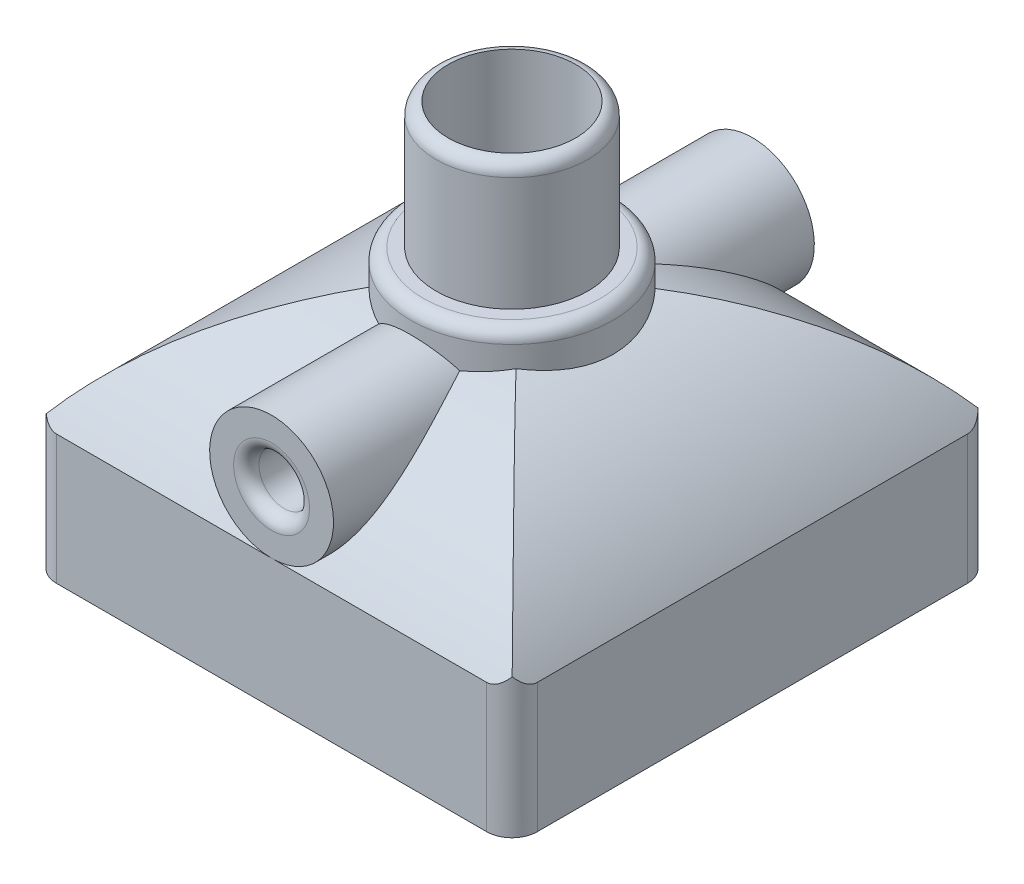
from build123d import *

# Parameters (mm, degrees)
SKETCH1_W            = 19
SKETCH1_H            = 19
BOSS_EXTRUDE1_DEPTH  = 10
CUT_EXTRUDE2_DEPTH   = 24.478713764
CUT_EXTRUDE5_START   = -18.816551442
CUT_EXTRUDE5_DEPTH   = 18.816551442
FILLET5_R            = 1
FILLET6_R            = 1
FILLET7_R            = 1
SKETCH8_R            = 2.447279851
SKETCH8_R_2          = 1
BOSS_EXTRUDE2_DEPTH  = 19
SKETCH10_R           = 4
BOSS_EXTRUDE4_DEPTH  = 4
BOSS_EXTRUDE5_START  = 6
SKETCH11_R           = 4
BOSS_EXTRUDE5_DEPTH  = 6
SKETCH12_R           = 4
SKETCH12_R_2         = 3
CUT_EXTRUDE7_DEPTH   = 5
FILLET8_R            = 0.5
SKETCH13_OUTSIDE_W   = 27.254
SKETCH13_OUTSIDE_H   = 27.254
SKETCH13_OUTSIDE_R   = 3
SKETCH13_OUTSIDE_R_2 = 2.519854455
CUT_EXTRUDE8_DEPTH   = 5
CUT_EXTRUDE9_START   = -5
SKETCH14_R           = 1
CUT_EXTRUDE9_DEPTH   = 5
SKETCH15_R           = 1
CUT_EXTRUDE10_DEPTH  = 5
FILLET10_R           = 0.5
FILLET11_R           = 0.5
FILLET12_R           = 0.5


# Read off the part's stored shape, not the designer's step: Cut-Extrude5
with BuildPart() as part:
    # Sketch1 → Boss-Extrude1 (new body)
    with BuildSketch(Plane(origin=(0, 0, 0), x_dir=(1, 0, 0), z_dir=(0, 1, 0))):
        Rectangle(SKETCH1_W, SKETCH1_H)
    extrude(amount=BOSS_EXTRUDE1_DEPTH)

    # Sketch6 → Cut-Extrude2 (cut, through all)
    with BuildSketch(Plane.XY.offset(9.5)):
        with BuildLine():
            Line((9.5, 10), (0.824310709, 10))
            ThreePointArc((0.824310709, 10), (5.720546849, 8.546731134), (9.5, 5.111494226))
            Line((9.5, 5.111494226), (9.5, 10))
        make_face()
        with BuildLine():
            ThreePointArc((-9.5, 4.83997424), (-5.679264699, 8.465280643), (-0.640862051, 10))
            Line((-0.640862051, 10), (-9.5, 10))
            Line((-9.5, 10), (-9.5, 4.83997424))
        make_face()
    extrude(amount=-CUT_EXTRUDE2_DEPTH, mode=Mode.SUBTRACT)

    # Cut-Extrude5 outline → Cut-Extrude5 (cut)
    with BuildSketch(Plane(origin=(9.5, 0, 0), x_dir=(0, 0, -1), z_dir=(1, 0, 0)).offset(CUT_EXTRUDE5_START)):
        with BuildLine():
            ThreePointArc((-9.5, 5.111494226), (-5.460586052, 8.64429594), (-0.267521294, 9.996934626))
            ThreePointArc((-0.267521294, 9.996934626), (0, 9.732461144), (0.267521294, 9.996934626))
            ThreePointArc((0.267521294, 9.996934626), (5.460586052, 8.64429594), (9.5, 5.111494226))
            Line((9.5, 5.111494226), (9.5, 10))
            Line((9.5, 10), (-9.5, 10))
            Line((-9.5, 10), (-9.5, 5.111494226))
        make_face()
    extrude(amount=CUT_EXTRUDE5_DEPTH, mode=Mode.SUBTRACT)

    # Fillet5
    fillet5_edges = [part.edges().sort_by_distance(p)[0] for p in [
        (-9.5, 2.41998712, -9.5),
    ]]
    fillet(fillet5_edges, radius=FILLET5_R)

    # Fillet6
    fillet6_edges = [part.edges().sort_by_distance(p)[0] for p in [
        (-9.5, 2.41998712, 9.5),
    ]]
    fillet(fillet6_edges, radius=FILLET6_R)

    # Fillet7
    fillet7_edges = [part.edges().sort_by_distance(p)[0] for p in [
        (9.5, 2.555747113, -9.5),
        (9.5, 2.555747113, 9.5),
    ]]
    fillet(fillet7_edges, radius=FILLET7_R)

    # Sketch8 → Boss-Extrude2 (add)
    with BuildSketch(Plane(origin=(0, 0, -9.5), x_dir=(-1, 0, 0), z_dir=(0, 0, -1))):
        with Locations((0, 7.558774078)):
            Circle(SKETCH8_R)
        with Locations((0, 7.558774078)):
            Circle(SKETCH8_R_2, mode=Mode.SUBTRACT)
    extrude(amount=-BOSS_EXTRUDE2_DEPTH)

    # Sketch10 → Boss-Extrude4 (add)
    with BuildSketch(Plane(origin=(0, 10, 0), x_dir=(1, 0, 0), z_dir=(0, 1, 0))):
        Circle(SKETCH10_R)
    extrude(amount=-BOSS_EXTRUDE4_DEPTH)

    # Sketch11 → Boss-Extrude5 (add)
    with BuildSketch(Plane(origin=(0, 10, 0), x_dir=(1, 0, 0), z_dir=(0, 1, 0)).offset(BOSS_EXTRUDE5_START)):
        with Locations(Location((0, 0, 0), (0, 0, 270))):
            Circle(SKETCH11_R)
    extrude(amount=-BOSS_EXTRUDE5_DEPTH)

    # Sketch12 → Cut-Extrude7 (cut)
    with BuildSketch(Plane(origin=(0, 16, 0), x_dir=(1, 0, 0), z_dir=(0, 1, 0))):
        with Locations(Location((0, 0, 0), (0, 0, 270))):
            Circle(SKETCH12_R)
        with Locations(Location((0, 0, 0), (0, 0, 270))):
            Circle(SKETCH12_R_2, mode=Mode.SUBTRACT)
    extrude(amount=-CUT_EXTRUDE7_DEPTH, mode=Mode.SUBTRACT)

    # Fillet8
    fillet8_edges = [part.edges().sort_by_distance(p)[0] for p in [
        (0, 11, -4),
    ]]
    fillet(fillet8_edges, radius=FILLET8_R)

    # Sketch13 outside → Cut-Extrude8 (cut)
    # profile 1 of 2: a face of its own
    with BuildSketch(Plane(origin=(0, 16, 0), x_dir=(1, 0, 0), z_dir=(0, 1, 0))):
        Rectangle(SKETCH13_OUTSIDE_W, SKETCH13_OUTSIDE_H)
        with Locations(Location((0, 0, 0), (0, 0, 270))):
            Circle(SKETCH13_OUTSIDE_R, mode=Mode.SUBTRACT)
    # profile 2 of 2: a face of its own
    with BuildSketch(Plane(origin=(0, 16, 0), x_dir=(1, 0, 0), z_dir=(0, 1, 0))):
        with Locations(Location((0, 0, 0), (0, 0, 270))):
            Circle(SKETCH13_OUTSIDE_R_2)
    extrude(amount=-CUT_EXTRUDE8_DEPTH, mode=Mode.SUBTRACT)

    # Sketch14 → Cut-Extrude9 (cut)
    with BuildSketch(Plane.XY.offset(9.5).offset(CUT_EXTRUDE9_START)):
        with Locations(Location((0, 7.558774078, 0), (0, 0, 180))):
            Circle(SKETCH14_R)
    extrude(amount=CUT_EXTRUDE9_DEPTH, mode=Mode.SUBTRACT)

    # Sketch15 → Cut-Extrude10 (cut)
    with BuildSketch(Plane(origin=(0, 0, -9.5), x_dir=(-1, 0, 0), z_dir=(0, 0, -1))):
        with Locations((0, 7.558774078)):
            Circle(SKETCH15_R)
    extrude(amount=-CUT_EXTRUDE10_DEPTH, mode=Mode.SUBTRACT)

    # Fillet10
    fillet10_edges = [part.edges().sort_by_distance(p)[0] for p in [
        (1, 7.558774078, -9.5),
    ]]
    fillet(fillet10_edges, radius=FILLET10_R)

    # Fillet11
    fillet11_edges = [part.edges().sort_by_distance(p)[0] for p in [
        (1, 7.558774078, 9.5),
    ]]
    fillet(fillet11_edges, radius=FILLET11_R)

    # Fillet12
    # the kernel refuses this fillet: 0.5 mm, written as the material it takes off along each edge
    with BuildSketch(Plane(origin=(0, 16, 0), x_dir=(0, 0, 1), z_dir=(-1, 0, 0))) as fillet12_piece_1:
        with BuildLine():
            CenterArc((3 - FILLET12_R, -FILLET12_R), FILLET12_R, 0, 90)
            Line((3 - FILLET12_R, 0), (3, 0))
            Line((3, 0), (3, -FILLET12_R))
        make_face()
    revolve(axis=Axis((0, 16, 0), (0, 1, 0)), mode=Mode.SUBTRACT)


solid = part.part
